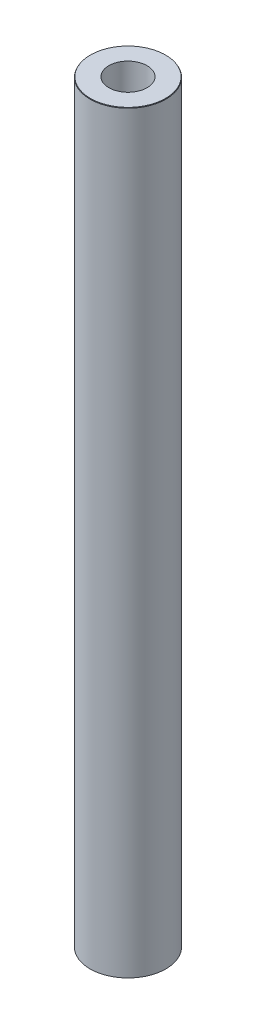
from build123d import *
from OCP.BRepFilletAPI import BRepFilletAPI_MakeChamfer

# Parameters (mm, degrees)
SKETCH1_R           = 15
BOSS_EXTRUDE1_DEPTH = 298.394476134
SKETCH2_R           = 7.569848804
CUT_EXTRUDE1_DEPTH  = 300.147561226
CHAMFER1_SIZE       = 0.219048259
CHAMFER1_SIZE2      = 0.12628098


with BuildPart() as part:
    # Sketch1 → Boss-Extrude1 (new body)
    with BuildSketch(Plane(origin=(0, 0, 0), x_dir=(1, 0, 0), z_dir=(0, 1, 0))):
        Circle(SKETCH1_R)
    extrude(amount=BOSS_EXTRUDE1_DEPTH)

    # Sketch2 → Cut-Extrude1 (cut, through all)
    with BuildSketch(Plane(origin=(0, 0, 0), x_dir=(1, 0, 0), z_dir=(0, 1, 0))):
        Circle(SKETCH2_R)
    extrude(amount=CUT_EXTRUDE1_DEPTH, mode=Mode.SUBTRACT)

    # Chamfer1: one chamfer whose edges measure the first distance from different faces: ONE call of the kernel's chamfer builder (chamfer() names one face for all edges)
    chamfer1_edges_1 = [part.edges().sort_by_distance(p)[0] for p in [
        (-15, 298.394476134, 0),
    ]]
    chamfer1_side_1 = [part.faces().sort_by_distance(p)[0] for p in [
        (-15, 149.197238067, 0),
    ]]
    chamfer1_edges_2 = [part.edges().sort_by_distance(p)[0] for p in [
        (-15, 0, 0),
    ]]
    chamfer1_side_2 = [part.faces().sort_by_distance(p)[0] for p in [
        (-14.575735931, 0, 0),
    ]]
    chamfer1 = BRepFilletAPI_MakeChamfer(part.part.solid().wrapped)
    for e in chamfer1_edges_1:
        chamfer1.Add(CHAMFER1_SIZE, CHAMFER1_SIZE2, e.wrapped, chamfer1_side_1[0].wrapped)  # the first distance lies on this face
    for e in chamfer1_edges_2:
        chamfer1.Add(CHAMFER1_SIZE, CHAMFER1_SIZE2, e.wrapped, chamfer1_side_2[0].wrapped)  # the first distance lies on this face
    add(Compound.cast(chamfer1.Shape()), mode=Mode.REPLACE)


solid = part.part
